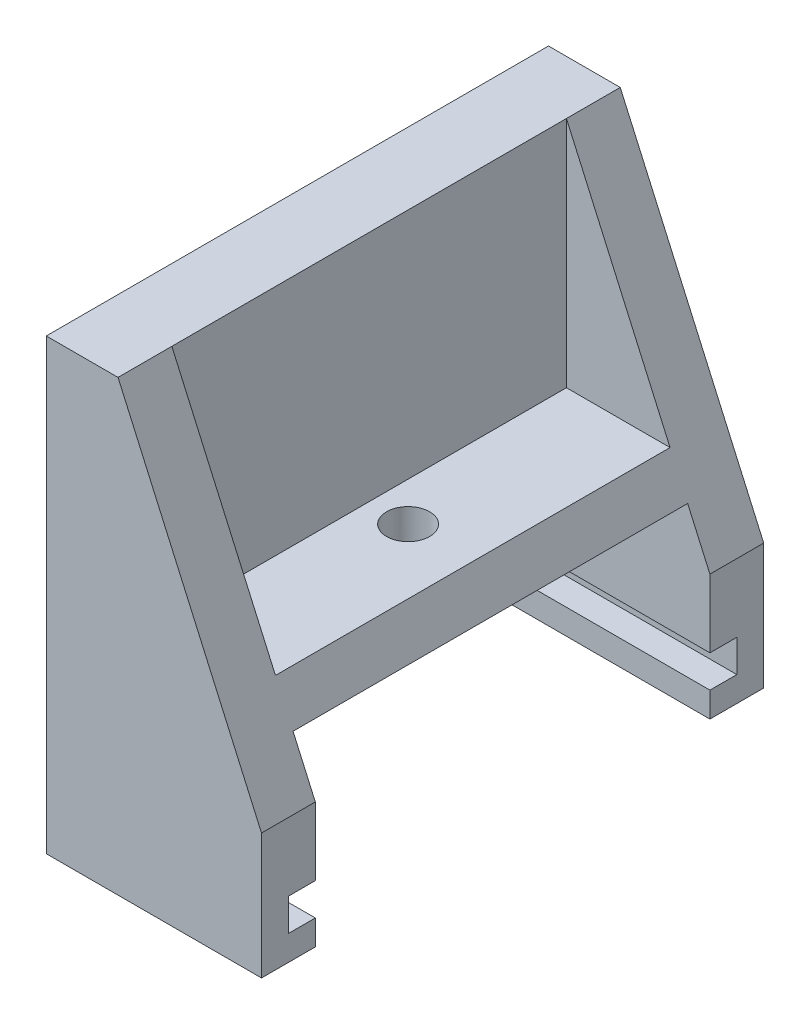
from build123d import *

# Parameters (mm, degrees)
BOSS_EXTRUDE1_DEPTH = 28
SKETCH4_W           = 22
SKETCH4_H           = 10
CUT_EXTRUDE2_DEPTH  = 15
SKETCH5_W           = 1.5
SKETCH5_H           = 1.8
CUT_EXTRUDE3_DEPTH  = 15
CUT_EXTRUDE4_DEPTH  = 11
SKETCH7_R           = 1.2
CUT_EXTRUDE5_DEPTH  = 4


with BuildPart() as part:
    # Sketch1 → Boss-Extrude1 (new body)
    with BuildSketch(Plane.XY):
        Polygon((0, 0), (0, -25), (12, -25), (12, -18), (4, 0), align=None)
    extrude(amount=-BOSS_EXTRUDE1_DEPTH)

    # Sketch4 → Cut-Extrude2 (cut)
    with BuildSketch(Plane.ZY):
        with Locations((-14, -20.207997185)):
            Rectangle(SKETCH4_W, SKETCH4_H)
    extrude(amount=-CUT_EXTRUDE2_DEPTH, mode=Mode.SUBTRACT)

    # Sketch5 → Cut-Extrude3 (cut)
    with BuildSketch(Plane.ZY):
        with Locations((-2.25, -22.7)):
            Rectangle(SKETCH5_W, SKETCH5_H)
    cut_extrude3 = extrude(amount=-CUT_EXTRUDE3_DEPTH, mode=Mode.SUBTRACT)

    # Mirror1: Cut-Extrude3 across plane
    add(cut_extrude3.mirror(Plane.XY.offset(-14)), mode=Mode.SUBTRACT)

    # Sketch6 → Cut-Extrude4 (cut, symmetric)
    with BuildSketch(Plane.XY.offset(-14)):
        Polygon((4, 0), (4, -13), (9.777777778, -13), align=None)
    extrude(amount=CUT_EXTRUDE4_DEPTH, both=True, mode=Mode.SUBTRACT)

    # Sketch7 → Cut-Extrude5 (cut)
    with BuildSketch(Plane(origin=(0, -13, 0), x_dir=(1, 0, 0), z_dir=(0, 1, 0))):
        with Locations((6.172753197, 14)):
            Circle(SKETCH7_R)
    extrude(amount=-CUT_EXTRUDE5_DEPTH, mode=Mode.SUBTRACT)


solid = part.part
